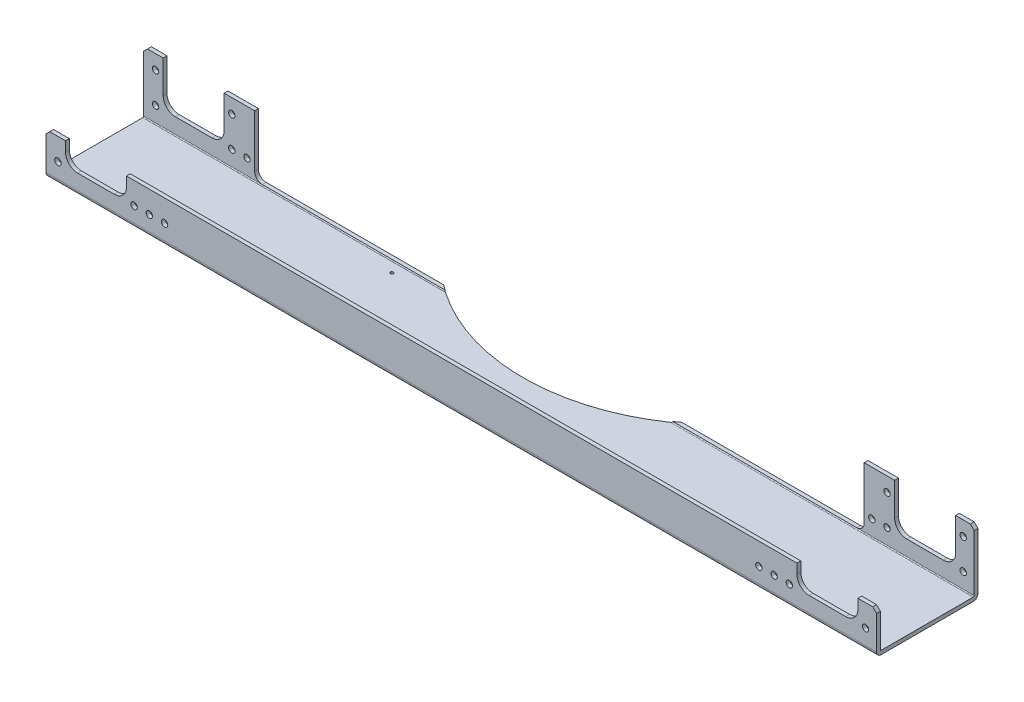
from build123d import *

# Parameters (mm, degrees)
SKETCH1_W                    = 692.15
SKETCH1_H                    = 84.582
BOSS_EXTRUDE1_DEPTH          = 53.975
SKETCH2_W                    = 84.582
SKETCH2_H                    = 50.8
CUT_EXTRUDE1_DEPTH           = 700.38475666
SKETCH3_W                    = 692.15
SKETCH3_H                    = 3.175
BOSS_EXTRUDE2_DEPTH          = 31.75
M2_CLEARANCE_HOLE1_D         = 2.54
M5_START                     = -84.582
M5_CLEARANCE_HOLE2_OUTLINE_R = 2.667
M5_CLEARANCE_HOLE2_DEPTH     = 84.582
CHAMFER1_SIZE                = 3.175
FILLET1_R                    = 0.762
FILLET2_R                    = 3.937
CUT_EXTRUDE7_DEPTH           = 58.674
CUT_EXTRUDE7_DEPTH_BACK      = 182.626
CUT_EXTRUDE8_DEPTH           = 66.802
CUT_EXTRUDE8_DEPTH_BACK      = 191.516
CUT_EXTRUDE9_REACH           = 701.385
CUT_EXTRUDE10_DEPTH          = 700.38475666
F_10_32_TAPPED_HOLE1_D       = 4.0386
F_10_32_TAPPED_HOLE1_DEPTH   = 13.716
F_10_32_TAPPED_HOLE1_TIP     = 1.213317848
SKETCH22_R                   = 5.159375
CUT_EXTRUDE11_DEPTH          = 3.175


# Read off the part's stored shape, not the designer's step: M5 Clearance Hole2
with BuildPart() as part:
    # Sketch1 → Boss-Extrude1 (new body)
    with BuildSketch(Plane(origin=(0, 53.975, 0), x_dir=(1, 0, 0), z_dir=(0, 1, 0))):
        with Locations((346.075, 42.291)):
            Rectangle(SKETCH1_W, SKETCH1_H)
    extrude(amount=-BOSS_EXTRUDE1_DEPTH)

    # Sketch2 → Cut-Extrude1 (cut, through all)
    with BuildSketch(Plane(origin=(692.15, 0, 0), x_dir=(0, 0, -1), z_dir=(1, 0, 0))):
        with Locations((39.116, 28.575)):
            Rectangle(SKETCH2_W, SKETCH2_H)
    extrude(amount=-CUT_EXTRUDE1_DEPTH, mode=Mode.SUBTRACT)

    # Sketch3 → Boss-Extrude2 (add)
    with BuildSketch(Plane(origin=(0, 3.175, 0), x_dir=(-1, 0, 0), z_dir=(0, 1, 0))):
        with Locations((-346.075, -1.5875)):
            Rectangle(SKETCH3_W, SKETCH3_H)
    extrude(amount=BOSS_EXTRUDE2_DEPTH)

    # M2 Clearance Hole1 (through all)
    with Locations(Plane(origin=(0, 3.175, 0), x_dir=(1, 0, 0), z_dir=(0, 1, 0))):
        with Locations((215.9, 5.842), (215.9, 72.39)):
            Hole(M2_CLEARANCE_HOLE1_D / 2)

    # M5 Clearance Hole2 outline → M5 Clearance Hole2 (cut)
    with BuildSketch(Plane.XY.offset(M5_START)):
        with Locations((683.006, 42.037)):
            Circle(M5_CLEARANCE_HOLE2_OUTLINE_R)
        with Locations((670.306, 42.037)):
            Circle(M5_CLEARANCE_HOLE2_OUTLINE_R)
        with Locations((657.606, 42.037)):
            Circle(M5_CLEARANCE_HOLE2_OUTLINE_R)
        with Locations((644.906, 42.037)):
            Circle(M5_CLEARANCE_HOLE2_OUTLINE_R)
        with Locations((632.206, 42.037)):
            Circle(M5_CLEARANCE_HOLE2_OUTLINE_R)
        with Locations((619.506, 42.037)):
            Circle(M5_CLEARANCE_HOLE2_OUTLINE_R)
        with Locations((594.106, 42.037)):
            Circle(M5_CLEARANCE_HOLE2_OUTLINE_R)
        with Locations((581.406, 42.037)):
            Circle(M5_CLEARANCE_HOLE2_OUTLINE_R)
        with Locations((568.706, 42.037)):
            Circle(M5_CLEARANCE_HOLE2_OUTLINE_R)
        with Locations((556.006, 42.037)):
            Circle(M5_CLEARANCE_HOLE2_OUTLINE_R)
        with Locations((543.306, 42.037)):
            Circle(M5_CLEARANCE_HOLE2_OUTLINE_R)
        with Locations((530.606, 42.037)):
            Circle(M5_CLEARANCE_HOLE2_OUTLINE_R)
        with Locations((517.906, 42.037)):
            Circle(M5_CLEARANCE_HOLE2_OUTLINE_R)
        with Locations((505.206, 42.037)):
            Circle(M5_CLEARANCE_HOLE2_OUTLINE_R)
        with Locations((492.506, 42.037)):
            Circle(M5_CLEARANCE_HOLE2_OUTLINE_R)
        with Locations((479.806, 42.037)):
            Circle(M5_CLEARANCE_HOLE2_OUTLINE_R)
        with Locations((467.106, 42.037)):
            Circle(M5_CLEARANCE_HOLE2_OUTLINE_R)
        with Locations((454.406, 42.037)):
            Circle(M5_CLEARANCE_HOLE2_OUTLINE_R)
        with Locations((441.706, 42.037)):
            Circle(M5_CLEARANCE_HOLE2_OUTLINE_R)
        with Locations((429.006, 42.037)):
            Circle(M5_CLEARANCE_HOLE2_OUTLINE_R)
        with Locations((416.306, 42.037)):
            Circle(M5_CLEARANCE_HOLE2_OUTLINE_R)
        with Locations((403.606, 42.037)):
            Circle(M5_CLEARANCE_HOLE2_OUTLINE_R)
        with Locations((390.906, 42.037)):
            Circle(M5_CLEARANCE_HOLE2_OUTLINE_R)
        with Locations((378.206, 42.037)):
            Circle(M5_CLEARANCE_HOLE2_OUTLINE_R)
        with Locations((365.506, 42.037)):
            Circle(M5_CLEARANCE_HOLE2_OUTLINE_R)
        with Locations((352.806, 42.037)):
            Circle(M5_CLEARANCE_HOLE2_OUTLINE_R)
        with Locations((340.106, 42.037)):
            Circle(M5_CLEARANCE_HOLE2_OUTLINE_R)
        with Locations((327.406, 42.037)):
            Circle(M5_CLEARANCE_HOLE2_OUTLINE_R)
        with Locations((314.706, 42.037)):
            Circle(M5_CLEARANCE_HOLE2_OUTLINE_R)
        with Locations((302.006, 42.037)):
            Circle(M5_CLEARANCE_HOLE2_OUTLINE_R)
        with Locations((289.306, 42.037)):
            Circle(M5_CLEARANCE_HOLE2_OUTLINE_R)
        with Locations((276.606, 42.037)):
            Circle(M5_CLEARANCE_HOLE2_OUTLINE_R)
        with Locations((263.906, 42.037)):
            Circle(M5_CLEARANCE_HOLE2_OUTLINE_R)
        with Locations((251.206, 42.037)):
            Circle(M5_CLEARANCE_HOLE2_OUTLINE_R)
        with Locations((238.506, 42.037)):
            Circle(M5_CLEARANCE_HOLE2_OUTLINE_R)
        with Locations((225.806, 42.037)):
            Circle(M5_CLEARANCE_HOLE2_OUTLINE_R)
        with Locations((213.106, 42.037)):
            Circle(M5_CLEARANCE_HOLE2_OUTLINE_R)
        with Locations((200.406, 42.037)):
            Circle(M5_CLEARANCE_HOLE2_OUTLINE_R)
        with Locations((187.706, 42.037)):
            Circle(M5_CLEARANCE_HOLE2_OUTLINE_R)
        with Locations((175.006, 42.037)):
            Circle(M5_CLEARANCE_HOLE2_OUTLINE_R)
        with Locations((162.306, 42.037)):
            Circle(M5_CLEARANCE_HOLE2_OUTLINE_R)
        with Locations((149.606, 42.037)):
            Circle(M5_CLEARANCE_HOLE2_OUTLINE_R)
        with Locations((136.906, 42.037)):
            Circle(M5_CLEARANCE_HOLE2_OUTLINE_R)
        with Locations((124.206, 42.037)):
            Circle(M5_CLEARANCE_HOLE2_OUTLINE_R)
        with Locations((683.006, 16.637)):
            Circle(M5_CLEARANCE_HOLE2_OUTLINE_R)
        with Locations((619.506, 16.637)):
            Circle(M5_CLEARANCE_HOLE2_OUTLINE_R)
        with Locations((606.806, 16.637)):
            Circle(M5_CLEARANCE_HOLE2_OUTLINE_R)
        with Locations((594.106, 16.637)):
            Circle(M5_CLEARANCE_HOLE2_OUTLINE_R)
        with Locations((111.506, 42.037)):
            Circle(M5_CLEARANCE_HOLE2_OUTLINE_R)
        with Locations((98.806, 42.037)):
            Circle(M5_CLEARANCE_HOLE2_OUTLINE_R)
        with Locations((73.406, 42.037)):
            Circle(M5_CLEARANCE_HOLE2_OUTLINE_R)
        with Locations((60.706, 42.037)):
            Circle(M5_CLEARANCE_HOLE2_OUTLINE_R)
        with Locations((48.006, 42.037)):
            Circle(M5_CLEARANCE_HOLE2_OUTLINE_R)
        with Locations((35.306, 42.037)):
            Circle(M5_CLEARANCE_HOLE2_OUTLINE_R)
        with Locations((22.606, 42.037)):
            Circle(M5_CLEARANCE_HOLE2_OUTLINE_R)
        with Locations((9.906, 42.037)):
            Circle(M5_CLEARANCE_HOLE2_OUTLINE_R)
        with Locations((98.806, 16.637)):
            Circle(M5_CLEARANCE_HOLE2_OUTLINE_R)
        with Locations((86.106, 16.637)):
            Circle(M5_CLEARANCE_HOLE2_OUTLINE_R)
        with Locations((73.406, 16.637)):
            Circle(M5_CLEARANCE_HOLE2_OUTLINE_R)
        with Locations((9.906, 16.637)):
            Circle(M5_CLEARANCE_HOLE2_OUTLINE_R)
    extrude(amount=M5_CLEARANCE_HOLE2_DEPTH, mode=Mode.SUBTRACT)

    # Chamfer1
    chamfer1_edges = [part.edges().sort_by_distance(p)[0] for p in [
        (692.15, 53.975, -82.9945),
        (0, 34.925, -1.5875),
        (692.15, 34.925, -1.5875),
        (0, 53.975, -82.9945),
    ]]
    chamfer(chamfer1_edges, length=CHAMFER1_SIZE)

    # Fillet1
    fillet1_edges = [part.edges().sort_by_distance(p)[0] for p in [
        (346.075, 3.175, -81.407),
        (346.075, 3.175, -3.175),
    ]]
    fillet(fillet1_edges, radius=FILLET1_R)

    # Fillet2
    fillet2_edges = [part.edges().sort_by_distance(p)[0] for p in [
        (346.075, 0, 0),
        (346.075, 0, -84.582),
    ]]
    fillet(fillet2_edges, radius=FILLET2_R)

    # Sketch15 → Cut-Extrude7 (cut, two sides: drawn at the far end of the back side and taken through both)
    with BuildSketch(Plane(origin=(0, 0, -84.582), x_dir=(-1, 0, 0), z_dir=(0, 0, -1)).offset(-CUT_EXTRUDE7_DEPTH_BACK)):
        with BuildLine():
            Line((-16.256, 27.686), (-16.256, 53.975))
            Line((-16.256, 53.975), (-67.056, 53.975))
            Line((-67.056, 53.975), (-67.056, 26.797))
            ThreePointArc((-67.056, 26.797), (-64.080204897, 19.612795103), (-56.896, 16.637))
            Line((-56.896, 16.637), (-26.416, 16.637))
            ThreePointArc((-26.416, 16.637), (-19.231795103, 19.612795103), (-16.256, 26.797))
            Line((-16.256, 26.797), (-16.256, 27.686))
        make_face()
    extrude(amount=CUT_EXTRUDE7_DEPTH + CUT_EXTRUDE7_DEPTH_BACK, mode=Mode.SUBTRACT)

    # Sketch16 → Cut-Extrude8 (cut, two sides: drawn at the far end of the back side and taken through both)
    with BuildSketch(Plane(origin=(0, 0, -84.582), x_dir=(-1, 0, 0), z_dir=(0, 0, -1)).offset(-CUT_EXTRUDE8_DEPTH_BACK)):
        with BuildLine():
            Line((-676.656, 27.3685), (-676.656, 26.797))
            ThreePointArc((-676.656, 26.797), (-673.680204897, 19.612795103), (-666.496, 16.637))
            Line((-666.496, 16.637), (-636.016, 16.637))
            ThreePointArc((-636.016, 16.637), (-628.831795103, 19.612795103), (-625.856, 26.797))
            Line((-625.856, 26.797), (-625.856, 53.975))
            Line((-625.856, 53.975), (-676.656, 53.975))
            Line((-676.656, 53.975), (-676.656, 27.3685))
        make_face()
    extrude(amount=CUT_EXTRUDE8_DEPTH + CUT_EXTRUDE8_DEPTH_BACK, mode=Mode.SUBTRACT)

    # Cut-Extrude9: up to this face of the body (flat: up to its plane)
    cut_extrude9_end = Plane(part.part.faces().sort_by_distance((346.012685058, 27.7502179, -81.407))[0])
    # Sketch17 → Cut-Extrude9 (cut, up to the picked face)
    with BuildSketch(Plane(origin=(0, 0, -84.582), x_dir=(-1, 0, 0), z_dir=(0, 0, -1)), mode=Mode.PRIVATE) as cut_extrude9_sk1:
        with BuildLine():
            Line((-600.456, 53.975), (-600.456, 10.287))
            ThreePointArc((-600.456, 10.287), (-598.596128061, 5.796871939), (-594.106, 3.937))
            Line((-594.106, 3.937), (-98.806, 3.937))
            ThreePointArc((-98.806, 3.937), (-94.315871939, 5.796871939), (-92.456, 10.287))
            Line((-92.456, 10.287), (-92.456, 53.975))
            Line((-92.456, 53.975), (-600.456, 53.975))
        make_face()
    cut_extrude9_tool1 = split(extrude(cut_extrude9_sk1.sketch, amount=-CUT_EXTRUDE9_REACH, mode=Mode.PRIVATE), bisect_by=cut_extrude9_end, keep=Keep.BOTH, mode=Mode.PRIVATE)
    add(cut_extrude9_tool1.solids().sort_by(Axis((346.456, 28.972079, -84.582), (0, 0, 1)))[0], mode=Mode.SUBTRACT)

    # Sketch18 → Cut-Extrude10 (cut, through all)
    with BuildSketch(Plane.XZ):
        with BuildLine():
            Line((246.845892421, -84.582), (445.304107579, -84.582))
            ThreePointArc((445.304107579, -84.582), (346.075, -51.435), (246.845892421, -84.582))
        make_face()
    extrude(amount=-CUT_EXTRUDE10_DEPTH, mode=Mode.SUBTRACT)

    # #10-32 Tapped Hole1
    with Locations(Plane(origin=(0, 0, 0), x_dir=(-1, 0, 0), z_dir=(0, -1, 0))):
        with Locations((-414.274, 32.893), (-414.274, 15.875), (-345.694, 15.841335103), (-345.694, 32.922547423), (-277.114, 32.952094846), (-277.114, 15.807670207)):
            Hole(F_10_32_TAPPED_HOLE1_D / 2, depth=F_10_32_TAPPED_HOLE1_DEPTH)
            with Locations((0, 0, -(F_10_32_TAPPED_HOLE1_DEPTH + F_10_32_TAPPED_HOLE1_TIP / 2))):  # 118° drill point
                Cone(0, F_10_32_TAPPED_HOLE1_D / 2, F_10_32_TAPPED_HOLE1_TIP, mode=Mode.SUBTRACT)

    # Sketch22 → Cut-Extrude11 (cut)
    with BuildSketch(Plane.XZ):
        with Locations(Location((161.98455352, -18.6699144, 0), (0, 0, 270))):
            Circle(SKETCH22_R)
        with Locations(Location((530.16544648, -18.6699144, 0), (0, 0, 270))):
            Circle(SKETCH22_R)
    extrude(amount=-CUT_EXTRUDE11_DEPTH, mode=Mode.SUBTRACT)


solid = part.part
